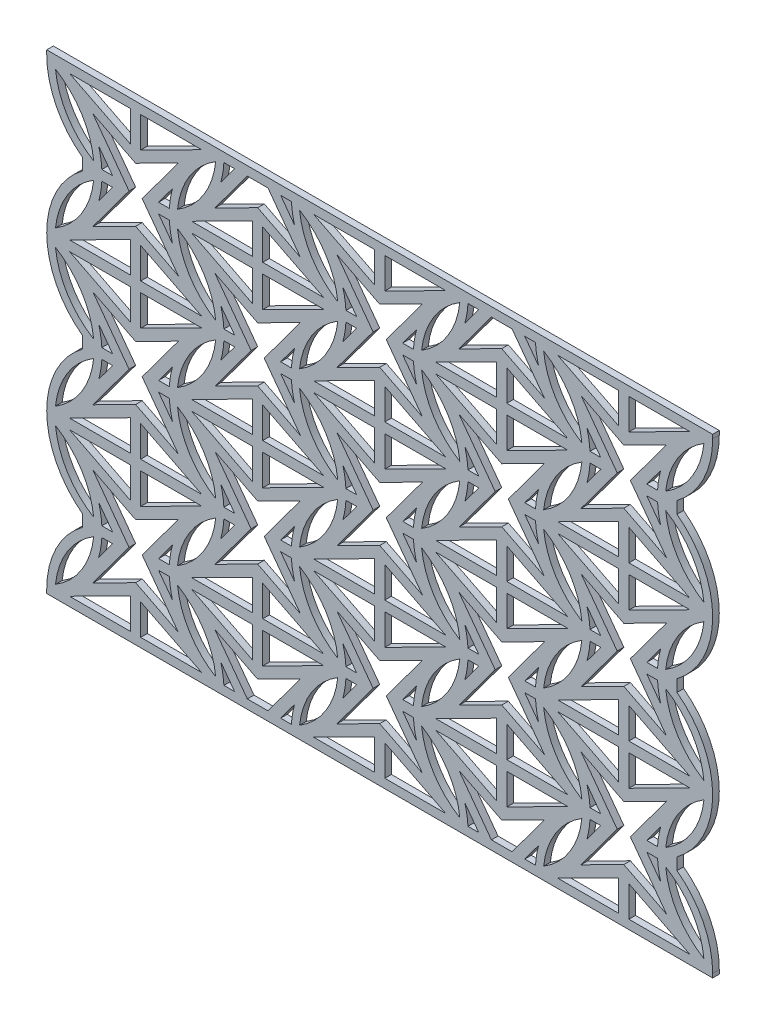
from build123d import *

# Parameters (mm, degrees)
BOSS_EXTRUDE1_DEPTH = 1.2


with BuildPart() as part:
    # Sketch2 → Boss-Extrude1 (new body)
    with BuildSketch(Plane.XY):
        with BuildLine():
            ThreePointArc((-16.1, 12.530515747), (-14.394273205, 5.318380217), (-9.638521876, -0.3655649))
            Line((-9.638521876, -0.3655649), (-9.638521876, -2.52568268))
            ThreePointArc((-9.638521876, -2.52568268), (-14.394273205, -8.209627797), (-16.1, -15.421763327))
            Line((-16.1, -15.421763327), (-16.1, -16.13821498))
            Line((-16.1, -16.13821498), (16.1, -16.13821498))
            Line((16.1, -16.13821498), (28.11489694, -16.13821498))
            Line((28.11489694, -16.13821498), (60.31489694, -16.13821498))
            Line((60.31489694, -16.13821498), (72.329793881, -16.13821498))
            Line((72.329793881, -16.13821498), (104.529793881, -16.13821498))
            Line((104.529793881, -16.13821498), (104.529793881, -15.421763327))
            ThreePointArc((104.529793881, -15.421763327), (102.824067086, -8.209627797), (98.068315757, -2.52568268))
            Line((98.068315757, -2.52568268), (98.068315757, -0.3655649))
            ThreePointArc((98.068315757, -0.3655649), (102.824067086, 5.318380217), (104.529793881, 12.530515747))
            ThreePointArc((104.529793881, 12.530515747), (102.824067086, 19.742651276), (98.068315757, 25.426596394))
            Line((98.068315757, 25.426596394), (98.068315757, 27.586714173))
            ThreePointArc((98.068315757, 27.586714173), (102.824067086, 33.270659291), (104.529793881, 40.48279482))
            ThreePointArc((104.529793881, 40.48279482), (102.824067086, 47.69493035), (98.068315757, 53.378875467))
            Line((98.068315757, 53.378875467), (98.068315757, 55.538993247))
            ThreePointArc((98.068315757, 55.538993247), (102.824067086, 61.222938364), (104.529793881, 68.435073894))
            Line((104.529793881, 68.435073894), (104.529793881, 69.151525547))
            Line((104.529793881, 69.151525547), (72.329793881, 69.151525547))
            Line((72.329793881, 69.151525547), (60.31489694, 69.151525547))
            Line((60.31489694, 69.151525547), (28.11489694, 69.151525547))
            Line((28.11489694, 69.151525547), (16.1, 69.151525547))
            Line((16.1, 69.151525547), (-16.1, 69.151525547))
            Line((-16.1, 69.151525547), (-16.1, 68.435073894))
            ThreePointArc((-16.1, 68.435073894), (-14.394273205, 61.222938364), (-9.638521876, 55.538993247))
            Line((-9.638521876, 55.538993247), (-9.638521876, 53.378875467))
            ThreePointArc((-9.638521876, 53.378875467), (-14.394273205, 47.69493035), (-16.1, 40.48279482))
            ThreePointArc((-16.1, 40.48279482), (-14.394273205, 33.270659291), (-9.638521876, 27.586714173))
            Line((-9.638521876, 27.586714173), (-9.638521876, 25.426596394))
            ThreePointArc((-9.638521876, 25.426596394), (-14.394273205, 19.742651276), (-16.1, 12.530515747))
        make_face()
        Polygon((-0.923439776, -14.341704437), (-0.923439776, -14.503231306), (-11.964043091, -14.503231306), (-0.923439776, -8.927020601), align=None, mode=Mode.SUBTRACT)
        with BuildLine():
            ThreePointArc((-14.512523795, -13.904820463), (-12.333614599, -7.624557835), (-7.594924676, -2.962566655))
            ThreePointArc((-7.594924676, -2.962566655), (-9.773833872, -9.242829282), (-14.512523795, -13.904820463))
        make_face(mode=Mode.SUBTRACT)
        Polygon((0.923439776, -14.503231306), (0.923439776, -8.927020601), (11.964043091, -14.503231306), align=None, mode=Mode.SUBTRACT)
        with BuildLine():
            ThreePointArc((7.594924675, -2.962566655), (12.333614599, -7.624557835), (14.512523795, -13.904820463))
            ThreePointArc((14.512523795, -13.904820463), (9.773833872, -9.242829282), (7.594924675, -2.962566655))
        make_face(mode=Mode.SUBTRACT)
        with BuildLine():
            Line((-6.115041916, -2.364155812), (-4.166134089, -2.364155812))
            Line((-4.166134089, -2.364155812), (-6.680912869, -5.761034295))
            ThreePointArc((-6.680912869, -5.761034295), (-6.306430231, -4.07784549), (-6.115041916, -2.364155812))
        make_face(mode=Mode.SUBTRACT)
        with BuildLine():
            Line((-6.680912869, 2.869786715), (-4.166134089, -0.527091769))
            Line((-4.166134089, -0.527091769), (-6.115041916, -0.527091769))
            ThreePointArc((-6.115041916, -0.527091769), (-6.306430231, 1.186597909), (-6.680912869, 2.869786715))
        make_face(mode=Mode.SUBTRACT)
        with BuildLine():
            Line((6.680912869, -5.761034295), (4.166134089, -2.364155812))
            Line((4.166134089, -2.364155812), (6.115041916, -2.364155812))
            ThreePointArc((6.115041916, -2.364155812), (6.306430231, -4.07784549), (6.680912869, -5.761034295))
        make_face(mode=Mode.SUBTRACT)
        Polygon((-1.18820817, -1.44562379), (-7.746127786, 7.412593169), (0, 3.500303283), (7.746127786, 7.412593169), (1.18820817, -1.44562379), (7.746127786, -10.303840749), (0, -6.391550864), (-7.746127786, -10.303840749), align=None, mode=Mode.SUBTRACT)
        with BuildLine():
            Line((6.115041916, -0.527091769), (4.166134089, -0.527091769))
            Line((4.166134089, -0.527091769), (6.680912869, 2.869786715))
            ThreePointArc((6.680912869, 2.869786715), (6.306430231, 1.186597909), (6.115041916, -0.527091769))
        make_face(mode=Mode.SUBTRACT)
        with BuildLine():
            Line((15.426535601, -11.106352822), (17.941314381, -14.503231306))
            Line((17.941314381, -14.503231306), (15.992406554, -14.503231306))
            ThreePointArc((15.992406554, -14.503231306), (15.801018239, -12.789541628), (15.426535601, -11.106352822))
        make_face(mode=Mode.SUBTRACT)
        with BuildLine():
            Line((28.222490386, -14.503231306), (26.273582559, -14.503231306))
            Line((26.273582559, -14.503231306), (28.788361339, -11.106352822))
            ThreePointArc((28.788361339, -11.106352822), (28.413878701, -12.789541628), (28.222490386, -14.503231306))
        make_face(mode=Mode.SUBTRACT)
        Polygon((22.10744847, -10.475836254), (29.853576256, -6.563546368), (23.975664726, -14.503231306), (20.239232214, -14.503231306), (14.361320684, -6.563546368), align=None, mode=Mode.SUBTRACT)
        Polygon((32.25085385, -14.503231306), (43.291457165, -8.927020601), (43.291457165, -14.341704437), (43.291457165, -14.503231306), align=None, mode=Mode.SUBTRACT)
        with BuildLine():
            ThreePointArc((36.619972265, -2.962566655), (34.441063069, -9.242829282), (29.702373146, -13.904820463))
            ThreePointArc((29.702373146, -13.904820463), (31.881282342, -7.624557835), (36.619972265, -2.962566655))
        make_face(mode=Mode.SUBTRACT)
        Polygon((21.184008694, -2.52568268), (21.184008694, -7.940366517), (10.14340538, -2.364155812), (21.184008694, -2.364155812), align=None, mode=Mode.SUBTRACT)
        Polygon((23.030888246, -7.940366517), (23.030888246, -2.52568268), (23.030888246, -2.364155812), (34.071491561, -2.364155812), align=None, mode=Mode.SUBTRACT)
        Polygon((10.14340538, -0.527091769), (21.184008694, 5.049118936), (21.184008694, -0.3655649), (21.184008694, -0.527091769), align=None, mode=Mode.SUBTRACT)
        Polygon((23.030888246, -0.527091769), (23.030888246, 5.049118936), (34.071491561, -0.527091769), align=None, mode=Mode.SUBTRACT)
        with BuildLine():
            Line((38.099855025, -2.364155812), (40.048762851, -2.364155812))
            Line((40.048762851, -2.364155812), (37.533984071, -5.761034295))
            ThreePointArc((37.533984071, -5.761034295), (37.90846671, -4.07784549), (38.099855025, -2.364155812))
        make_face(mode=Mode.SUBTRACT)
        Polygon((45.40310511, -1.44562379), (51.961024726, -10.303840749), (44.21489694, -6.391550864), (36.468769155, -10.303840749), (43.026688771, -1.44562379), (36.468769155, 7.412593169), (44.21489694, 3.500303283), (51.961024726, 7.412593169), align=None, mode=Mode.SUBTRACT)
        with BuildLine():
            Line((37.533984071, 2.869786715), (40.048762851, -0.527091769))
            Line((40.048762851, -0.527091769), (38.099855025, -0.527091769))
            ThreePointArc((38.099855025, -0.527091769), (37.90846671, 1.186597909), (37.533984071, 2.869786715))
        make_face(mode=Mode.SUBTRACT)
        with BuildLine():
            ThreePointArc((-14.512523795, 11.013572882), (-9.773833872, 6.351581702), (-7.594924676, 0.071319074))
            ThreePointArc((-7.594924676, 0.071319074), (-12.333614599, 4.733310255), (-14.512523795, 11.013572882))
        make_face(mode=Mode.SUBTRACT)
        Polygon((-11.964043091, 11.611983725), (-0.923439776, 11.611983725), (-0.923439776, 11.450456857), (-0.923439776, 6.03577302), align=None, mode=Mode.SUBTRACT)
        Polygon((0.923439776, 6.03577302), (0.923439776, 11.450456857), (0.923439776, 11.611983725), (11.964043091, 11.611983725), align=None, mode=Mode.SUBTRACT)
        with BuildLine():
            ThreePointArc((7.594924675, 0.071319074), (9.773833872, 6.351581702), (14.512523795, 11.013572882))
            ThreePointArc((14.512523795, 11.013572882), (12.333614599, 4.733310255), (7.594924675, 0.071319074))
        make_face(mode=Mode.SUBTRACT)
        with BuildLine():
            ThreePointArc((-7.594924676, 24.989712419), (-9.773833872, 18.709449792), (-14.512523795, 14.047458611))
            ThreePointArc((-14.512523795, 14.047458611), (-12.333614599, 20.327721238), (-7.594924676, 24.989712419))
        make_face(mode=Mode.SUBTRACT)
        Polygon((-11.964043091, 13.449047768), (-0.923439776, 19.025258473), (-0.923439776, 13.610574637), (-0.923439776, 13.449047768), align=None, mode=Mode.SUBTRACT)
        with BuildLine():
            Line((-6.115041916, 25.588123262), (-4.166134089, 25.588123262))
            Line((-4.166134089, 25.588123262), (-6.680912869, 22.191244779))
            ThreePointArc((-6.680912869, 22.191244779), (-6.306430231, 23.874433584), (-6.115041916, 25.588123262))
        make_face(mode=Mode.SUBTRACT)
        Polygon((0.923439776, 13.449047768), (0.923439776, 19.025258473), (11.964043091, 13.449047768), align=None, mode=Mode.SUBTRACT)
        with BuildLine():
            ThreePointArc((7.594924675, 24.989712419), (12.333614599, 20.327721238), (14.512523795, 14.047458611))
            ThreePointArc((14.512523795, 14.047458611), (9.773833872, 18.709449792), (7.594924675, 24.989712419))
        make_face(mode=Mode.SUBTRACT)
        Polygon((7.746127786, 17.648438324), (0, 21.56072821), (-7.746127786, 17.648438324), (-1.18820817, 26.506655284), (-7.746127786, 35.364872243), (0, 31.452582357), (7.746127786, 35.364872243), (1.18820817, 26.506655284), align=None, mode=Mode.SUBTRACT)
        with BuildLine():
            Line((6.680912869, 22.191244779), (4.166134089, 25.588123262))
            Line((4.166134089, 25.588123262), (6.115041916, 25.588123262))
            ThreePointArc((6.115041916, 25.588123262), (6.306430231, 23.874433584), (6.680912869, 22.191244779))
        make_face(mode=Mode.SUBTRACT)
        with BuildLine():
            Line((15.992406554, 11.611983725), (17.941314381, 11.611983725))
            Line((17.941314381, 11.611983725), (15.426535601, 8.215105242))
            ThreePointArc((15.426535601, 8.215105242), (15.801018239, 9.898294047), (15.992406554, 11.611983725))
        make_face(mode=Mode.SUBTRACT)
        with BuildLine():
            Line((28.788361339, 8.215105242), (26.273582559, 11.611983725))
            Line((26.273582559, 11.611983725), (28.222490386, 11.611983725))
            ThreePointArc((28.222490386, 11.611983725), (28.413878701, 9.898294047), (28.788361339, 8.215105242))
        make_face(mode=Mode.SUBTRACT)
        with BuildLine():
            Line((15.426535601, 16.845926251), (17.941314381, 13.449047768))
            Line((17.941314381, 13.449047768), (15.992406554, 13.449047768))
            ThreePointArc((15.992406554, 13.449047768), (15.801018239, 15.162737446), (15.426535601, 16.845926251))
        make_face(mode=Mode.SUBTRACT)
        Polygon((23.29565664, 12.530515747), (29.853576256, 3.672298787), (22.10744847, 7.584588673), (14.361320684, 3.672298787), (20.9192403, 12.530515747), (14.361320684, 21.388732706), (22.10744847, 17.47644282), (29.853576256, 21.388732706), align=None, mode=Mode.SUBTRACT)
        with BuildLine():
            Line((28.222490386, 13.449047768), (26.273582559, 13.449047768))
            Line((26.273582559, 13.449047768), (28.788361339, 16.845926251))
            ThreePointArc((28.788361339, 16.845926251), (28.413878701, 15.162737446), (28.222490386, 13.449047768))
        make_face(mode=Mode.SUBTRACT)
        with BuildLine():
            ThreePointArc((36.619972265, 0.071319074), (31.881282342, 4.733310255), (29.702373146, 11.013572882))
            ThreePointArc((29.702373146, 11.013572882), (34.441063069, 6.351581702), (36.619972265, 0.071319074))
        make_face(mode=Mode.SUBTRACT)
        Polygon((43.291457165, 11.450456857), (43.291457165, 6.03577302), (32.25085385, 11.611983725), (43.291457165, 11.611983725), align=None, mode=Mode.SUBTRACT)
        Polygon((21.184008694, 25.426596394), (21.184008694, 20.011912557), (10.14340538, 25.588123262), (21.184008694, 25.588123262), align=None, mode=Mode.SUBTRACT)
        Polygon((23.030888246, 25.588123262), (34.071491561, 25.588123262), (23.030888246, 20.011912557), (23.030888246, 25.426596394), align=None, mode=Mode.SUBTRACT)
        with BuildLine():
            ThreePointArc((29.702373146, 14.047458611), (31.881282342, 20.327721238), (36.619972265, 24.989712419))
            ThreePointArc((36.619972265, 24.989712419), (34.441063069, 18.709449792), (29.702373146, 14.047458611))
        make_face(mode=Mode.SUBTRACT)
        Polygon((32.25085385, 13.449047768), (43.291457165, 19.025258473), (43.291457165, 13.610574637), (43.291457165, 13.449047768), align=None, mode=Mode.SUBTRACT)
        with BuildLine():
            Line((38.099855025, 25.588123262), (40.048762851, 25.588123262))
            Line((40.048762851, 25.588123262), (37.533984071, 22.191244779))
            ThreePointArc((37.533984071, 22.191244779), (37.90846671, 23.874433584), (38.099855025, 25.588123262))
        make_face(mode=Mode.SUBTRACT)
        Polygon((45.40310511, 26.506655284), (51.961024726, 17.648438324), (44.21489694, 21.56072821), (36.468769155, 17.648438324), (43.026688771, 26.506655284), (36.468769155, 35.364872243), (44.21489694, 31.452582357), (51.961024726, 35.364872243), align=None, mode=Mode.SUBTRACT)
        Polygon((45.138336716, -14.503231306), (45.138336716, -8.927020601), (56.178940031, -14.503231306), align=None, mode=Mode.SUBTRACT)
        with BuildLine():
            ThreePointArc((58.727420735, -13.904820463), (53.988730812, -9.242829282), (51.809821616, -2.962566655))
            ThreePointArc((51.809821616, -2.962566655), (56.548511539, -7.624557835), (58.727420735, -13.904820463))
        make_face(mode=Mode.SUBTRACT)
        with BuildLine():
            Line((59.641432542, -11.106352822), (62.156211322, -14.503231306))
            Line((62.156211322, -14.503231306), (60.207303495, -14.503231306))
            ThreePointArc((60.207303495, -14.503231306), (60.01591518, -12.789541628), (59.641432542, -11.106352822))
        make_face(mode=Mode.SUBTRACT)
        with BuildLine():
            Line((72.437387326, -14.503231306), (70.4884795, -14.503231306))
            Line((70.4884795, -14.503231306), (73.00325828, -11.106352822))
            ThreePointArc((73.00325828, -11.106352822), (72.628775641, -12.789541628), (72.437387326, -14.503231306))
        make_face(mode=Mode.SUBTRACT)
        Polygon((64.454129155, -14.503231306), (58.576217625, -6.563546368), (66.322345411, -10.475836254), (74.068473196, -6.563546368), (68.190561667, -14.503231306), align=None, mode=Mode.SUBTRACT)
        with BuildLine():
            Line((50.89580981, -5.761034295), (48.381031029, -2.364155812))
            Line((48.381031029, -2.364155812), (50.329938856, -2.364155812))
            ThreePointArc((50.329938856, -2.364155812), (50.521327171, -4.07784549), (50.89580981, -5.761034295))
        make_face(mode=Mode.SUBTRACT)
        with BuildLine():
            Line((50.329938856, -0.527091769), (48.381031029, -0.527091769))
            Line((48.381031029, -0.527091769), (50.89580981, 2.869786715))
            ThreePointArc((50.89580981, 2.869786715), (50.521327171, 1.186597909), (50.329938856, -0.527091769))
        make_face(mode=Mode.SUBTRACT)
        Polygon((65.398905635, -2.364155812), (65.398905635, -2.52568268), (65.398905635, -7.940366517), (54.35830232, -2.364155812), align=None, mode=Mode.SUBTRACT)
        Polygon((78.286388501, -2.364155812), (67.245785186, -7.940366517), (67.245785186, -2.52568268), (67.245785186, -2.364155812), align=None, mode=Mode.SUBTRACT)
        Polygon((54.35830232, -0.527091769), (65.398905635, 5.049118936), (65.398905635, -0.3655649), (65.398905635, -0.527091769), align=None, mode=Mode.SUBTRACT)
        Polygon((67.245785186, -0.527091769), (67.245785186, 5.049118936), (78.286388501, -0.527091769), align=None, mode=Mode.SUBTRACT)
        Polygon((87.506354105, -8.927020601), (87.506354105, -14.341704437), (87.506354105, -14.503231306), (76.46575079, -14.503231306), align=None, mode=Mode.SUBTRACT)
        with BuildLine():
            ThreePointArc((73.917270086, -13.904820463), (76.096179282, -7.624557835), (80.834869205, -2.962566655))
            ThreePointArc((80.834869205, -2.962566655), (78.655960009, -9.242829282), (73.917270086, -13.904820463))
        make_face(mode=Mode.SUBTRACT)
        Polygon((89.353233657, -8.927020601), (100.393836971, -14.503231306), (89.353233657, -14.503231306), align=None, mode=Mode.SUBTRACT)
        with BuildLine():
            ThreePointArc((96.024718556, -2.962566655), (100.763408479, -7.624557835), (102.942317676, -13.904820463))
            ThreePointArc((102.942317676, -13.904820463), (98.203627753, -9.242829282), (96.024718556, -2.962566655))
        make_face(mode=Mode.SUBTRACT)
        with BuildLine():
            Line((82.314751965, -2.364155812), (84.263659792, -2.364155812))
            Line((84.263659792, -2.364155812), (81.748881012, -5.761034295))
            ThreePointArc((81.748881012, -5.761034295), (82.12336365, -4.07784549), (82.314751965, -2.364155812))
        make_face(mode=Mode.SUBTRACT)
        Polygon((88.429793881, -6.391550864), (80.683666095, -10.303840749), (87.241585711, -1.44562379), (80.683666095, 7.412593169), (88.429793881, 3.500303283), (96.175921667, 7.412593169), (89.618002051, -1.44562379), (96.175921667, -10.303840749), align=None, mode=Mode.SUBTRACT)
        with BuildLine():
            Line((81.748881012, 2.869786715), (84.263659792, -0.527091769))
            Line((84.263659792, -0.527091769), (82.314751965, -0.527091769))
            ThreePointArc((82.314751965, -0.527091769), (82.12336365, 1.186597909), (81.748881012, 2.869786715))
        make_face(mode=Mode.SUBTRACT)
        with BuildLine():
            Line((95.11070675, -5.761034295), (92.59592797, -2.364155812))
            Line((92.59592797, -2.364155812), (94.544835797, -2.364155812))
            ThreePointArc((94.544835797, -2.364155812), (94.736224112, -4.07784549), (95.11070675, -5.761034295))
        make_face(mode=Mode.SUBTRACT)
        with BuildLine():
            Line((94.544835797, -0.527091769), (92.59592797, -0.527091769))
            Line((92.59592797, -0.527091769), (95.11070675, 2.869786715))
            ThreePointArc((95.11070675, 2.869786715), (94.736224112, 1.186597909), (94.544835797, -0.527091769))
        make_face(mode=Mode.SUBTRACT)
        Polygon((45.138336716, 11.611983725), (56.178940031, 11.611983725), (45.138336716, 6.03577302), (45.138336716, 11.450456857), align=None, mode=Mode.SUBTRACT)
        with BuildLine():
            ThreePointArc((51.809821616, 0.071319074), (53.988730812, 6.351581702), (58.727420735, 11.013572882))
            ThreePointArc((58.727420735, 11.013572882), (56.548511539, 4.733310255), (51.809821616, 0.071319074))
        make_face(mode=Mode.SUBTRACT)
        with BuildLine():
            Line((60.207303495, 11.611983725), (62.156211322, 11.611983725))
            Line((62.156211322, 11.611983725), (59.641432542, 8.215105242))
            ThreePointArc((59.641432542, 8.215105242), (60.01591518, 9.898294047), (60.207303495, 11.611983725))
        make_face(mode=Mode.SUBTRACT)
        with BuildLine():
            Line((73.00325828, 8.215105242), (70.4884795, 11.611983725))
            Line((70.4884795, 11.611983725), (72.437387326, 11.611983725))
            ThreePointArc((72.437387326, 11.611983725), (72.628775641, 9.898294047), (73.00325828, 8.215105242))
        make_face(mode=Mode.SUBTRACT)
        Polygon((67.510553581, 12.530515747), (74.068473196, 3.672298787), (66.322345411, 7.584588673), (58.576217625, 3.672298787), (65.134137241, 12.530515747), (58.576217625, 21.388732706), (66.322345411, 17.47644282), (74.068473196, 21.388732706), align=None, mode=Mode.SUBTRACT)
        with BuildLine():
            Line((59.641432542, 16.845926251), (62.156211322, 13.449047768))
            Line((62.156211322, 13.449047768), (60.207303495, 13.449047768))
            ThreePointArc((60.207303495, 13.449047768), (60.01591518, 15.162737446), (59.641432542, 16.845926251))
        make_face(mode=Mode.SUBTRACT)
        with BuildLine():
            Line((72.437387326, 13.449047768), (70.4884795, 13.449047768))
            Line((70.4884795, 13.449047768), (73.00325828, 16.845926251))
            ThreePointArc((73.00325828, 16.845926251), (72.628775641, 15.162737446), (72.437387326, 13.449047768))
        make_face(mode=Mode.SUBTRACT)
        Polygon((45.138336716, 13.449047768), (45.138336716, 19.025258473), (56.178940031, 13.449047768), align=None, mode=Mode.SUBTRACT)
        with BuildLine():
            ThreePointArc((58.727420735, 14.047458611), (53.988730812, 18.709449792), (51.809821616, 24.989712419))
            ThreePointArc((51.809821616, 24.989712419), (56.548511539, 20.327721238), (58.727420735, 14.047458611))
        make_face(mode=Mode.SUBTRACT)
        with BuildLine():
            Line((50.89580981, 22.191244779), (48.381031029, 25.588123262))
            Line((48.381031029, 25.588123262), (50.329938856, 25.588123262))
            ThreePointArc((50.329938856, 25.588123262), (50.521327171, 23.874433584), (50.89580981, 22.191244779))
        make_face(mode=Mode.SUBTRACT)
        Polygon((65.398905635, 25.426596394), (65.398905635, 20.011912557), (54.35830232, 25.588123262), (65.398905635, 25.588123262), align=None, mode=Mode.SUBTRACT)
        Polygon((67.245785186, 25.588123262), (78.286388501, 25.588123262), (67.245785186, 20.011912557), (67.245785186, 25.426596394), align=None, mode=Mode.SUBTRACT)
        with BuildLine():
            ThreePointArc((80.834869205, 0.071319074), (76.096179282, 4.733310255), (73.917270086, 11.013572882))
            ThreePointArc((73.917270086, 11.013572882), (78.655960009, 6.351581702), (80.834869205, 0.071319074))
        make_face(mode=Mode.SUBTRACT)
        Polygon((87.506354105, 11.611983725), (87.506354105, 11.450456857), (87.506354105, 6.03577302), (76.46575079, 11.611983725), align=None, mode=Mode.SUBTRACT)
        Polygon((100.393836971, 11.611983725), (89.353233657, 6.03577302), (89.353233657, 11.450456857), (89.353233657, 11.611983725), align=None, mode=Mode.SUBTRACT)
        with BuildLine():
            ThreePointArc((96.024718556, 0.071319074), (98.203627753, 6.351581702), (102.942317676, 11.013572882))
            ThreePointArc((102.942317676, 11.013572882), (100.763408479, 4.733310255), (96.024718556, 0.071319074))
        make_face(mode=Mode.SUBTRACT)
        with BuildLine():
            ThreePointArc((73.917270086, 14.047458611), (76.096179282, 20.327721238), (80.834869205, 24.989712419))
            ThreePointArc((80.834869205, 24.989712419), (78.655960009, 18.709449792), (73.917270086, 14.047458611))
        make_face(mode=Mode.SUBTRACT)
        Polygon((87.506354105, 19.025258473), (87.506354105, 13.610574637), (87.506354105, 13.449047768), (76.46575079, 13.449047768), align=None, mode=Mode.SUBTRACT)
        with BuildLine():
            Line((82.314751965, 25.588123262), (84.263659792, 25.588123262))
            Line((84.263659792, 25.588123262), (81.748881012, 22.191244779))
            ThreePointArc((81.748881012, 22.191244779), (82.12336365, 23.874433584), (82.314751965, 25.588123262))
        make_face(mode=Mode.SUBTRACT)
        Polygon((88.429793881, 21.56072821), (80.683666095, 17.648438324), (87.241585711, 26.506655284), (80.683666095, 35.364872243), (88.429793881, 31.452582357), (96.175921667, 35.364872243), (89.618002051, 26.506655284), (96.175921667, 17.648438324), align=None, mode=Mode.SUBTRACT)
        Polygon((89.353233657, 19.025258473), (100.393836971, 13.449047768), (89.353233657, 13.449047768), align=None, mode=Mode.SUBTRACT)
        with BuildLine():
            ThreePointArc((96.024718556, 24.989712419), (100.763408479, 20.327721238), (102.942317676, 14.047458611))
            ThreePointArc((102.942317676, 14.047458611), (98.203627753, 18.709449792), (96.024718556, 24.989712419))
        make_face(mode=Mode.SUBTRACT)
        with BuildLine():
            Line((95.11070675, 22.191244779), (92.59592797, 25.588123262))
            Line((92.59592797, 25.588123262), (94.544835797, 25.588123262))
            ThreePointArc((94.544835797, 25.588123262), (94.736224112, 23.874433584), (95.11070675, 22.191244779))
        make_face(mode=Mode.SUBTRACT)
        with BuildLine():
            Line((-6.680912869, 30.822065788), (-4.166134089, 27.425187305))
            Line((-4.166134089, 27.425187305), (-6.115041916, 27.425187305))
            ThreePointArc((-6.115041916, 27.425187305), (-6.306430231, 29.138876983), (-6.680912869, 30.822065788))
        make_face(mode=Mode.SUBTRACT)
        with BuildLine():
            ThreePointArc((-14.512523795, 38.965851956), (-9.773833872, 34.303860775), (-7.594924676, 28.023598148))
            ThreePointArc((-7.594924676, 28.023598148), (-12.333614599, 32.685589329), (-14.512523795, 38.965851956))
        make_face(mode=Mode.SUBTRACT)
        Polygon((-0.923439776, 39.40273593), (-0.923439776, 33.988052094), (-11.964043091, 39.564262799), (-0.923439776, 39.564262799), align=None, mode=Mode.SUBTRACT)
        with BuildLine():
            Line((6.115041916, 27.425187305), (4.166134089, 27.425187305))
            Line((4.166134089, 27.425187305), (6.680912869, 30.822065788))
            ThreePointArc((6.680912869, 30.822065788), (6.306430231, 29.138876983), (6.115041916, 27.425187305))
        make_face(mode=Mode.SUBTRACT)
        Polygon((11.964043091, 39.564262799), (0.923439776, 33.988052094), (0.923439776, 39.40273593), (0.923439776, 39.564262799), align=None, mode=Mode.SUBTRACT)
        with BuildLine():
            ThreePointArc((14.512523795, 38.965851956), (12.333614599, 32.685589329), (7.594924675, 28.023598148))
            ThreePointArc((7.594924675, 28.023598148), (9.773833872, 34.303860775), (14.512523795, 38.965851956))
        make_face(mode=Mode.SUBTRACT)
        with BuildLine():
            ThreePointArc((-7.594924676, 52.941991493), (-9.773833872, 46.661728865), (-14.512523795, 41.999737685))
            ThreePointArc((-14.512523795, 41.999737685), (-12.333614599, 48.280000312), (-7.594924676, 52.941991493))
        make_face(mode=Mode.SUBTRACT)
        Polygon((-11.964043091, 41.401326842), (-0.923439776, 46.977537547), (-0.923439776, 41.56285371), (-0.923439776, 41.401326842), align=None, mode=Mode.SUBTRACT)
        Polygon((0.923439776, 41.401326842), (0.923439776, 46.977537547), (11.964043091, 41.401326842), align=None, mode=Mode.SUBTRACT)
        with BuildLine():
            ThreePointArc((7.594924675, 52.941991493), (12.333614599, 48.280000312), (14.512523795, 41.999737685))
            ThreePointArc((14.512523795, 41.999737685), (9.773833872, 46.661728865), (7.594924675, 52.941991493))
        make_face(mode=Mode.SUBTRACT)
        Polygon((10.14340538, 27.425187305), (21.184008694, 33.00139801), (21.184008694, 27.586714173), (21.184008694, 27.425187305), align=None, mode=Mode.SUBTRACT)
        Polygon((23.030888246, 27.425187305), (23.030888246, 33.00139801), (34.071491561, 27.425187305), align=None, mode=Mode.SUBTRACT)
        with BuildLine():
            Line((37.533984071, 30.822065788), (40.048762851, 27.425187305))
            Line((40.048762851, 27.425187305), (38.099855025, 27.425187305))
            ThreePointArc((38.099855025, 27.425187305), (37.90846671, 29.138876983), (37.533984071, 30.822065788))
        make_face(mode=Mode.SUBTRACT)
        with BuildLine():
            ThreePointArc((29.702373146, 38.965851956), (34.441063069, 34.303860775), (36.619972265, 28.023598148))
            ThreePointArc((36.619972265, 28.023598148), (31.881282342, 32.685589329), (29.702373146, 38.965851956))
        make_face(mode=Mode.SUBTRACT)
        Polygon((43.291457165, 39.40273593), (43.291457165, 33.988052094), (32.25085385, 39.564262799), (43.291457165, 39.564262799), align=None, mode=Mode.SUBTRACT)
        with BuildLine():
            Line((15.992406554, 39.564262799), (17.941314381, 39.564262799))
            Line((17.941314381, 39.564262799), (15.426535601, 36.167384316))
            ThreePointArc((15.426535601, 36.167384316), (15.801018239, 37.850573121), (15.992406554, 39.564262799))
        make_face(mode=Mode.SUBTRACT)
        with BuildLine():
            Line((28.788361339, 36.167384316), (26.273582559, 39.564262799))
            Line((26.273582559, 39.564262799), (28.222490386, 39.564262799))
            ThreePointArc((28.222490386, 39.564262799), (28.413878701, 37.850573121), (28.788361339, 36.167384316))
        make_face(mode=Mode.SUBTRACT)
        Polygon((29.853576256, 31.624577861), (22.10744847, 35.536867747), (14.361320684, 31.624577861), (20.9192403, 40.48279482), (14.361320684, 49.34101178), (22.10744847, 45.428721894), (29.853576256, 49.34101178), (23.29565664, 40.48279482), align=None, mode=Mode.SUBTRACT)
        with BuildLine():
            Line((15.426535601, 44.798205325), (17.941314381, 41.401326842))
            Line((17.941314381, 41.401326842), (15.992406554, 41.401326842))
            ThreePointArc((15.992406554, 41.401326842), (15.801018239, 43.11501652), (15.426535601, 44.798205325))
        make_face(mode=Mode.SUBTRACT)
        with BuildLine():
            Line((28.222490386, 41.401326842), (26.273582559, 41.401326842))
            Line((26.273582559, 41.401326842), (28.788361339, 44.798205325))
            ThreePointArc((28.788361339, 44.798205325), (28.413878701, 43.11501652), (28.222490386, 41.401326842))
        make_face(mode=Mode.SUBTRACT)
        with BuildLine():
            ThreePointArc((36.619972265, 52.941991493), (34.441063069, 46.661728865), (29.702373146, 41.999737685))
            ThreePointArc((29.702373146, 41.999737685), (31.881282342, 48.280000312), (36.619972265, 52.941991493))
        make_face(mode=Mode.SUBTRACT)
        Polygon((32.25085385, 41.401326842), (43.291457165, 46.977537547), (43.291457165, 41.56285371), (43.291457165, 41.401326842), align=None, mode=Mode.SUBTRACT)
        with BuildLine():
            Line((-6.115041916, 53.540402336), (-4.166134089, 53.540402336))
            Line((-4.166134089, 53.540402336), (-6.680912869, 50.143523852))
            ThreePointArc((-6.680912869, 50.143523852), (-6.306430231, 51.826712658), (-6.115041916, 53.540402336))
        make_face(mode=Mode.SUBTRACT)
        with BuildLine():
            Line((-6.680912869, 58.774344862), (-4.166134089, 55.377466379))
            Line((-4.166134089, 55.377466379), (-6.115041916, 55.377466379))
            ThreePointArc((-6.115041916, 55.377466379), (-6.306430231, 57.091156057), (-6.680912869, 58.774344862))
        make_face(mode=Mode.SUBTRACT)
        with BuildLine():
            Line((6.680912869, 50.143523852), (4.166134089, 53.540402336))
            Line((4.166134089, 53.540402336), (6.115041916, 53.540402336))
            ThreePointArc((6.115041916, 53.540402336), (6.306430231, 51.826712658), (6.680912869, 50.143523852))
        make_face(mode=Mode.SUBTRACT)
        Polygon((7.746127786, 45.600717398), (0, 49.513007284), (-7.746127786, 45.600717398), (-1.18820817, 54.458934357), (-7.746127786, 63.317151316), (0, 59.404861431), (7.746127786, 63.317151316), (1.18820817, 54.458934357), align=None, mode=Mode.SUBTRACT)
        with BuildLine():
            Line((6.115041916, 55.377466379), (4.166134089, 55.377466379))
            Line((4.166134089, 55.377466379), (6.680912869, 58.774344862))
            ThreePointArc((6.680912869, 58.774344862), (6.306430231, 57.091156057), (6.115041916, 55.377466379))
        make_face(mode=Mode.SUBTRACT)
        with BuildLine():
            ThreePointArc((-14.512523795, 66.91813103), (-9.773833872, 62.256139849), (-7.594924676, 55.975877222))
            ThreePointArc((-7.594924676, 55.975877222), (-12.333614599, 60.637868402), (-14.512523795, 66.91813103))
        make_face(mode=Mode.SUBTRACT)
        Polygon((-0.923439776, 67.355015004), (-0.923439776, 61.940331168), (-11.964043091, 67.516541873), (-0.923439776, 67.516541873), align=None, mode=Mode.SUBTRACT)
        with BuildLine():
            ThreePointArc((14.512523795, 66.91813103), (12.333614599, 60.637868402), (7.594924675, 55.975877222))
            ThreePointArc((7.594924675, 55.975877222), (9.773833872, 62.256139849), (14.512523795, 66.91813103))
        make_face(mode=Mode.SUBTRACT)
        Polygon((11.964043091, 67.516541873), (0.923439776, 61.940331168), (0.923439776, 67.355015004), (0.923439776, 67.516541873), align=None, mode=Mode.SUBTRACT)
        Polygon((21.184008694, 53.378875467), (21.184008694, 47.964191631), (10.14340538, 53.540402336), (21.184008694, 53.540402336), align=None, mode=Mode.SUBTRACT)
        Polygon((34.071491561, 53.540402336), (23.030888246, 47.964191631), (23.030888246, 53.378875467), (23.030888246, 53.540402336), align=None, mode=Mode.SUBTRACT)
        Polygon((21.184008694, 60.953677084), (21.184008694, 55.538993247), (21.184008694, 55.377466379), (10.14340538, 55.377466379), align=None, mode=Mode.SUBTRACT)
        Polygon((23.030888246, 55.377466379), (23.030888246, 60.953677084), (34.071491561, 55.377466379), align=None, mode=Mode.SUBTRACT)
        with BuildLine():
            Line((38.099855025, 53.540402336), (40.048762851, 53.540402336))
            Line((40.048762851, 53.540402336), (37.533984071, 50.143523852))
            ThreePointArc((37.533984071, 50.143523852), (37.90846671, 51.826712658), (38.099855025, 53.540402336))
        make_face(mode=Mode.SUBTRACT)
        Polygon((51.961024726, 45.600717398), (44.21489694, 49.513007284), (36.468769155, 45.600717398), (43.026688771, 54.458934357), (36.468769155, 63.317151316), (44.21489694, 59.404861431), (51.961024726, 63.317151316), (45.40310511, 54.458934357), align=None, mode=Mode.SUBTRACT)
        with BuildLine():
            Line((37.533984071, 58.774344862), (40.048762851, 55.377466379))
            Line((40.048762851, 55.377466379), (38.099855025, 55.377466379))
            ThreePointArc((38.099855025, 55.377466379), (37.90846671, 57.091156057), (37.533984071, 58.774344862))
        make_face(mode=Mode.SUBTRACT)
        Polygon((29.853576256, 59.576856935), (22.10744847, 63.489146821), (14.361320684, 59.576856935), (20.239232214, 67.516541873), (23.975664726, 67.516541873), align=None, mode=Mode.SUBTRACT)
        with BuildLine():
            Line((15.992406554, 67.516541873), (17.941314381, 67.516541873))
            Line((17.941314381, 67.516541873), (15.426535601, 64.119663389))
            ThreePointArc((15.426535601, 64.119663389), (15.801018239, 65.802852195), (15.992406554, 67.516541873))
        make_face(mode=Mode.SUBTRACT)
        with BuildLine():
            Line((28.788361339, 64.119663389), (26.273582559, 67.516541873))
            Line((26.273582559, 67.516541873), (28.222490386, 67.516541873))
            ThreePointArc((28.222490386, 67.516541873), (28.413878701, 65.802852195), (28.788361339, 64.119663389))
        make_face(mode=Mode.SUBTRACT)
        with BuildLine():
            ThreePointArc((36.619972265, 55.975877222), (31.881282342, 60.637868402), (29.702373146, 66.91813103))
            ThreePointArc((29.702373146, 66.91813103), (34.441063069, 62.256139849), (36.619972265, 55.975877222))
        make_face(mode=Mode.SUBTRACT)
        Polygon((43.291457165, 67.355015004), (43.291457165, 61.940331168), (32.25085385, 67.516541873), (43.291457165, 67.516541873), align=None, mode=Mode.SUBTRACT)
        with BuildLine():
            Line((50.329938856, 27.425187305), (48.381031029, 27.425187305))
            Line((48.381031029, 27.425187305), (50.89580981, 30.822065788))
            ThreePointArc((50.89580981, 30.822065788), (50.521327171, 29.138876983), (50.329938856, 27.425187305))
        make_face(mode=Mode.SUBTRACT)
        Polygon((45.138336716, 39.564262799), (56.178940031, 39.564262799), (45.138336716, 33.988052094), (45.138336716, 39.40273593), align=None, mode=Mode.SUBTRACT)
        with BuildLine():
            ThreePointArc((51.809821616, 28.023598148), (53.988730812, 34.303860775), (58.727420735, 38.965851956))
            ThreePointArc((58.727420735, 38.965851956), (56.548511539, 32.685589329), (51.809821616, 28.023598148))
        make_face(mode=Mode.SUBTRACT)
        Polygon((54.35830232, 27.425187305), (65.398905635, 33.00139801), (65.398905635, 27.586714173), (65.398905635, 27.425187305), align=None, mode=Mode.SUBTRACT)
        Polygon((67.245785186, 27.425187305), (67.245785186, 33.00139801), (78.286388501, 27.425187305), align=None, mode=Mode.SUBTRACT)
        Polygon((45.138336716, 41.401326842), (45.138336716, 46.977537547), (56.178940031, 41.401326842), align=None, mode=Mode.SUBTRACT)
        with BuildLine():
            ThreePointArc((51.809821616, 52.941991493), (56.548511539, 48.280000312), (58.727420735, 41.999737685))
            ThreePointArc((58.727420735, 41.999737685), (53.988730812, 46.661728865), (51.809821616, 52.941991493))
        make_face(mode=Mode.SUBTRACT)
        with BuildLine():
            Line((60.207303495, 39.564262799), (62.156211322, 39.564262799))
            Line((62.156211322, 39.564262799), (59.641432542, 36.167384316))
            ThreePointArc((59.641432542, 36.167384316), (60.01591518, 37.850573121), (60.207303495, 39.564262799))
        make_face(mode=Mode.SUBTRACT)
        Polygon((67.510553581, 40.48279482), (74.068473196, 31.624577861), (66.322345411, 35.536867747), (58.576217625, 31.624577861), (65.134137241, 40.48279482), (58.576217625, 49.34101178), (66.322345411, 45.428721894), (74.068473196, 49.34101178), align=None, mode=Mode.SUBTRACT)
        with BuildLine():
            Line((73.00325828, 36.167384316), (70.4884795, 39.564262799))
            Line((70.4884795, 39.564262799), (72.437387326, 39.564262799))
            ThreePointArc((72.437387326, 39.564262799), (72.628775641, 37.850573121), (73.00325828, 36.167384316))
        make_face(mode=Mode.SUBTRACT)
        with BuildLine():
            Line((59.641432542, 44.798205325), (62.156211322, 41.401326842))
            Line((62.156211322, 41.401326842), (60.207303495, 41.401326842))
            ThreePointArc((60.207303495, 41.401326842), (60.01591518, 43.11501652), (59.641432542, 44.798205325))
        make_face(mode=Mode.SUBTRACT)
        with BuildLine():
            Line((72.437387326, 41.401326842), (70.4884795, 41.401326842))
            Line((70.4884795, 41.401326842), (73.00325828, 44.798205325))
            ThreePointArc((73.00325828, 44.798205325), (72.628775641, 43.11501652), (72.437387326, 41.401326842))
        make_face(mode=Mode.SUBTRACT)
        with BuildLine():
            Line((81.748881012, 30.822065788), (84.263659792, 27.425187305))
            Line((84.263659792, 27.425187305), (82.314751965, 27.425187305))
            ThreePointArc((82.314751965, 27.425187305), (82.12336365, 29.138876983), (81.748881012, 30.822065788))
        make_face(mode=Mode.SUBTRACT)
        with BuildLine():
            ThreePointArc((80.834869205, 28.023598148), (76.096179282, 32.685589329), (73.917270086, 38.965851956))
            ThreePointArc((73.917270086, 38.965851956), (78.655960009, 34.303860775), (80.834869205, 28.023598148))
        make_face(mode=Mode.SUBTRACT)
        Polygon((87.506354105, 39.564262799), (87.506354105, 39.40273593), (87.506354105, 33.988052094), (76.46575079, 39.564262799), align=None, mode=Mode.SUBTRACT)
        with BuildLine():
            Line((94.544835797, 27.425187305), (92.59592797, 27.425187305))
            Line((92.59592797, 27.425187305), (95.11070675, 30.822065788))
            ThreePointArc((95.11070675, 30.822065788), (94.736224112, 29.138876983), (94.544835797, 27.425187305))
        make_face(mode=Mode.SUBTRACT)
        Polygon((100.393836971, 39.564262799), (89.353233657, 33.988052094), (89.353233657, 39.40273593), (89.353233657, 39.564262799), align=None, mode=Mode.SUBTRACT)
        with BuildLine():
            ThreePointArc((96.024718556, 28.023598148), (98.203627753, 34.303860775), (102.942317676, 38.965851956))
            ThreePointArc((102.942317676, 38.965851956), (100.763408479, 32.685589329), (96.024718556, 28.023598148))
        make_face(mode=Mode.SUBTRACT)
        with BuildLine():
            ThreePointArc((73.917270086, 41.999737685), (76.096179282, 48.280000312), (80.834869205, 52.941991493))
            ThreePointArc((80.834869205, 52.941991493), (78.655960009, 46.661728865), (73.917270086, 41.999737685))
        make_face(mode=Mode.SUBTRACT)
        Polygon((87.506354105, 46.977537547), (87.506354105, 41.56285371), (87.506354105, 41.401326842), (76.46575079, 41.401326842), align=None, mode=Mode.SUBTRACT)
        Polygon((89.353233657, 41.401326842), (89.353233657, 46.977537547), (100.393836971, 41.401326842), align=None, mode=Mode.SUBTRACT)
        with BuildLine():
            ThreePointArc((102.942317676, 41.999737685), (98.203627753, 46.661728865), (96.024718556, 52.941991493))
            ThreePointArc((96.024718556, 52.941991493), (100.763408479, 48.280000312), (102.942317676, 41.999737685))
        make_face(mode=Mode.SUBTRACT)
        with BuildLine():
            Line((50.89580981, 50.143523852), (48.381031029, 53.540402336))
            Line((48.381031029, 53.540402336), (50.329938856, 53.540402336))
            ThreePointArc((50.329938856, 53.540402336), (50.521327171, 51.826712658), (50.89580981, 50.143523852))
        make_face(mode=Mode.SUBTRACT)
        with BuildLine():
            Line((50.329938856, 55.377466379), (48.381031029, 55.377466379))
            Line((48.381031029, 55.377466379), (50.89580981, 58.774344862))
            ThreePointArc((50.89580981, 58.774344862), (50.521327171, 57.091156057), (50.329938856, 55.377466379))
        make_face(mode=Mode.SUBTRACT)
        Polygon((65.398905635, 53.378875467), (65.398905635, 47.964191631), (54.35830232, 53.540402336), (65.398905635, 53.540402336), align=None, mode=Mode.SUBTRACT)
        Polygon((67.245785186, 53.540402336), (78.286388501, 53.540402336), (67.245785186, 47.964191631), (67.245785186, 53.378875467), align=None, mode=Mode.SUBTRACT)
        Polygon((65.398905635, 60.953677084), (65.398905635, 55.538993247), (65.398905635, 55.377466379), (54.35830232, 55.377466379), align=None, mode=Mode.SUBTRACT)
        Polygon((67.245785186, 55.377466379), (67.245785186, 60.953677084), (78.286388501, 55.377466379), align=None, mode=Mode.SUBTRACT)
        with BuildLine():
            ThreePointArc((58.727420735, 66.91813103), (56.548511539, 60.637868402), (51.809821616, 55.975877222))
            ThreePointArc((51.809821616, 55.975877222), (53.988730812, 62.256139849), (58.727420735, 66.91813103))
        make_face(mode=Mode.SUBTRACT)
        Polygon((56.178940031, 67.516541873), (45.138336716, 61.940331168), (45.138336716, 67.355015004), (45.138336716, 67.516541873), align=None, mode=Mode.SUBTRACT)
        Polygon((74.068473196, 59.576856935), (66.322345411, 63.489146821), (58.576217625, 59.576856935), (64.454129155, 67.516541873), (68.190561667, 67.516541873), align=None, mode=Mode.SUBTRACT)
        with BuildLine():
            Line((60.207303495, 67.516541873), (62.156211322, 67.516541873))
            Line((62.156211322, 67.516541873), (59.641432542, 64.119663389))
            ThreePointArc((59.641432542, 64.119663389), (60.01591518, 65.802852195), (60.207303495, 67.516541873))
        make_face(mode=Mode.SUBTRACT)
        with BuildLine():
            Line((73.00325828, 64.119663389), (70.4884795, 67.516541873))
            Line((70.4884795, 67.516541873), (72.437387326, 67.516541873))
            ThreePointArc((72.437387326, 67.516541873), (72.628775641, 65.802852195), (73.00325828, 64.119663389))
        make_face(mode=Mode.SUBTRACT)
        with BuildLine():
            Line((82.314751965, 53.540402336), (84.263659792, 53.540402336))
            Line((84.263659792, 53.540402336), (81.748881012, 50.143523852))
            ThreePointArc((81.748881012, 50.143523852), (82.12336365, 51.826712658), (82.314751965, 53.540402336))
        make_face(mode=Mode.SUBTRACT)
        Polygon((96.175921667, 45.600717398), (88.429793881, 49.513007284), (80.683666095, 45.600717398), (87.241585711, 54.458934357), (80.683666095, 63.317151316), (88.429793881, 59.404861431), (96.175921667, 63.317151316), (89.618002051, 54.458934357), align=None, mode=Mode.SUBTRACT)
        with BuildLine():
            Line((81.748881012, 58.774344862), (84.263659792, 55.377466379))
            Line((84.263659792, 55.377466379), (82.314751965, 55.377466379))
            ThreePointArc((82.314751965, 55.377466379), (82.12336365, 57.091156057), (81.748881012, 58.774344862))
        make_face(mode=Mode.SUBTRACT)
        with BuildLine():
            Line((95.11070675, 50.143523852), (92.59592797, 53.540402336))
            Line((92.59592797, 53.540402336), (94.544835797, 53.540402336))
            ThreePointArc((94.544835797, 53.540402336), (94.736224112, 51.826712658), (95.11070675, 50.143523852))
        make_face(mode=Mode.SUBTRACT)
        with BuildLine():
            Line((94.544835797, 55.377466379), (92.59592797, 55.377466379))
            Line((92.59592797, 55.377466379), (95.11070675, 58.774344862))
            ThreePointArc((95.11070675, 58.774344862), (94.736224112, 57.091156057), (94.544835797, 55.377466379))
        make_face(mode=Mode.SUBTRACT)
        with BuildLine():
            ThreePointArc((80.834869205, 55.975877222), (76.096179282, 60.637868402), (73.917270086, 66.91813103))
            ThreePointArc((73.917270086, 66.91813103), (78.655960009, 62.256139849), (80.834869205, 55.975877222))
        make_face(mode=Mode.SUBTRACT)
        Polygon((87.506354105, 67.355015004), (87.506354105, 61.940331168), (76.46575079, 67.516541873), (87.506354105, 67.516541873), align=None, mode=Mode.SUBTRACT)
        with BuildLine():
            ThreePointArc((96.024718556, 55.975877222), (98.203627753, 62.256139849), (102.942317676, 66.91813103))
            ThreePointArc((102.942317676, 66.91813103), (100.763408479, 60.637868402), (96.024718556, 55.975877222))
        make_face(mode=Mode.SUBTRACT)
        Polygon((89.353233657, 67.516541873), (100.393836971, 67.516541873), (89.353233657, 61.940331168), (89.353233657, 67.355015004), align=None, mode=Mode.SUBTRACT)
    extrude(amount=BOSS_EXTRUDE1_DEPTH)


solid = part.part
